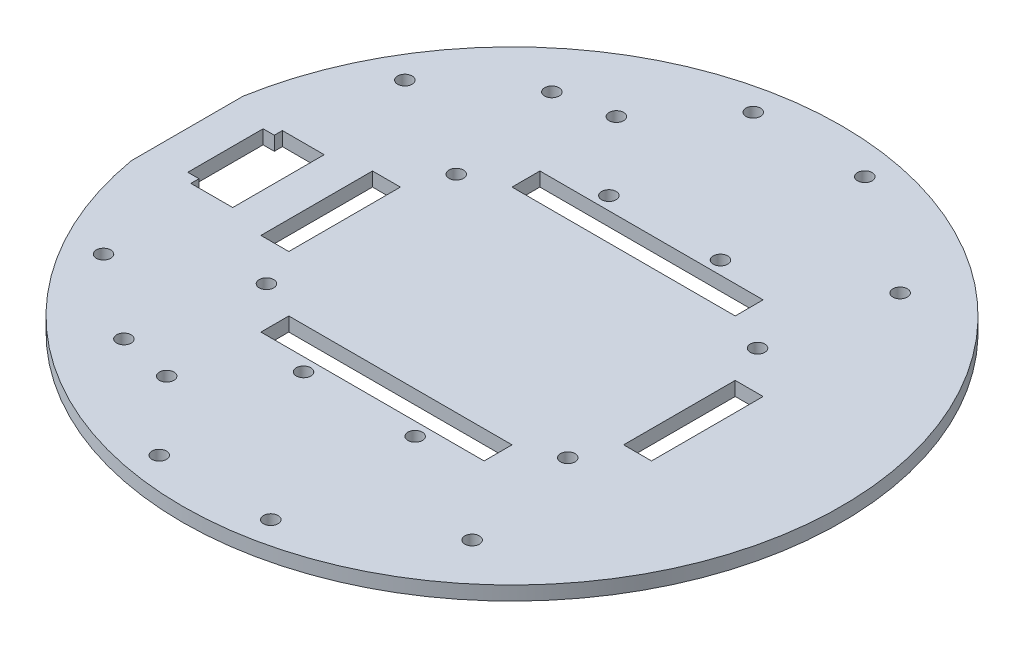
from build123d import *

# Parameters (mm, degrees)
SKETCH1_R           = 1.651
SKETCH1_W           = 50.8
SKETCH1_H           = 6.35
SKETCH1_W_2         = 6.35
SKETCH1_H_2         = 25.4
BOSS_EXTRUDE1_DEPTH = 3.175


with BuildPart() as part:
    # Sketch1 → Boss-Extrude1 (new body)
    with BuildSketch(Plane(origin=(0, 0, 0), x_dir=(1, 0, 0), z_dir=(0, 1, 0))):
        with BuildLine():
            Line((-73.916912814, 12.7), (-73.916912814, -12.7))
            ThreePointArc((-73.916912814, -12.7), (75, 0), (-73.916912814, 12.7))
        make_face()
        with Locations((-34.29, 21.59)):
            Circle(SKETCH1_R, mode=Mode.SUBTRACT)
        with Locations((34.29, 21.59)):
            Circle(SKETCH1_R, mode=Mode.SUBTRACT)
        with Locations((-34.29, -21.59)):
            Circle(SKETCH1_R, mode=Mode.SUBTRACT)
        with Locations((34.29, -21.59)):
            Circle(SKETCH1_R, mode=Mode.SUBTRACT)
        with Locations((39.626912814, -48.698461806)):
            Circle(SKETCH1_R, mode=Mode.SUBTRACT)
        with Locations((-39.626912814, -48.698461806)):
            Circle(SKETCH1_R, mode=Mode.SUBTRACT)
        with Locations((-58.676912814, -34.29)):
            Circle(SKETCH1_R, mode=Mode.SUBTRACT)
        with Locations((-58.676912814, 34.29)):
            Circle(SKETCH1_R, mode=Mode.SUBTRACT)
        with Locations((-39.626912814, 48.698461806)):
            Circle(SKETCH1_R, mode=Mode.SUBTRACT)
        with Locations((39.626912814, 48.698461806)):
            Circle(SKETCH1_R, mode=Mode.SUBTRACT)
        with Locations((12.7, -67.593386492)):
            Circle(SKETCH1_R, mode=Mode.SUBTRACT)
        with Locations((12.7, -34.743386492)):
            Circle(SKETCH1_R, mode=Mode.SUBTRACT)
        with Locations((12.7, 34.743386492)):
            Circle(SKETCH1_R, mode=Mode.SUBTRACT)
        with Locations((12.7, 67.593386492)):
            Circle(SKETCH1_R, mode=Mode.SUBTRACT)
        with Locations((-27.425, -51.168386492)):
            Circle(SKETCH1_R, mode=Mode.SUBTRACT)
        with Locations((-12.7, -34.743386492)):
            Circle(SKETCH1_R, mode=Mode.SUBTRACT)
        with Locations((-12.7, -67.593386492)):
            Circle(SKETCH1_R, mode=Mode.SUBTRACT)
        with Locations((-12.7, 67.593386492)):
            Circle(SKETCH1_R, mode=Mode.SUBTRACT)
        with Locations((-27.425, 51.168386492)):
            Circle(SKETCH1_R, mode=Mode.SUBTRACT)
        with Locations((-12.7, 34.743386492)):
            Circle(SKETCH1_R, mode=Mode.SUBTRACT)
        with Locations((0, 28.575)):
            Rectangle(SKETCH1_W, SKETCH1_H, mode=Mode.SUBTRACT)
        with Locations((41.275, 0)):
            Rectangle(SKETCH1_W_2, SKETCH1_H_2, mode=Mode.SUBTRACT)
        with Locations((0, -28.575)):
            Rectangle(SKETCH1_W, SKETCH1_H, mode=Mode.SUBTRACT)
        with Locations((-41.275, 0)):
            Rectangle(SKETCH1_W_2, SKETCH1_H_2, mode=Mode.SUBTRACT)
        Polygon((-65.215956407, 8.5725), (-62.675956407, 8.5725), (-62.675956407, 10.414), (-53.150956407, 10.414), (-53.150956407, 8.5725), (-53.150956407, -8.5725), (-53.150956407, -10.414), (-62.675956407, -10.414), (-62.675956407, -8.5725), (-65.215956407, -8.5725), align=None, mode=Mode.SUBTRACT)
    extrude(amount=BOSS_EXTRUDE1_DEPTH)


solid = part.part
